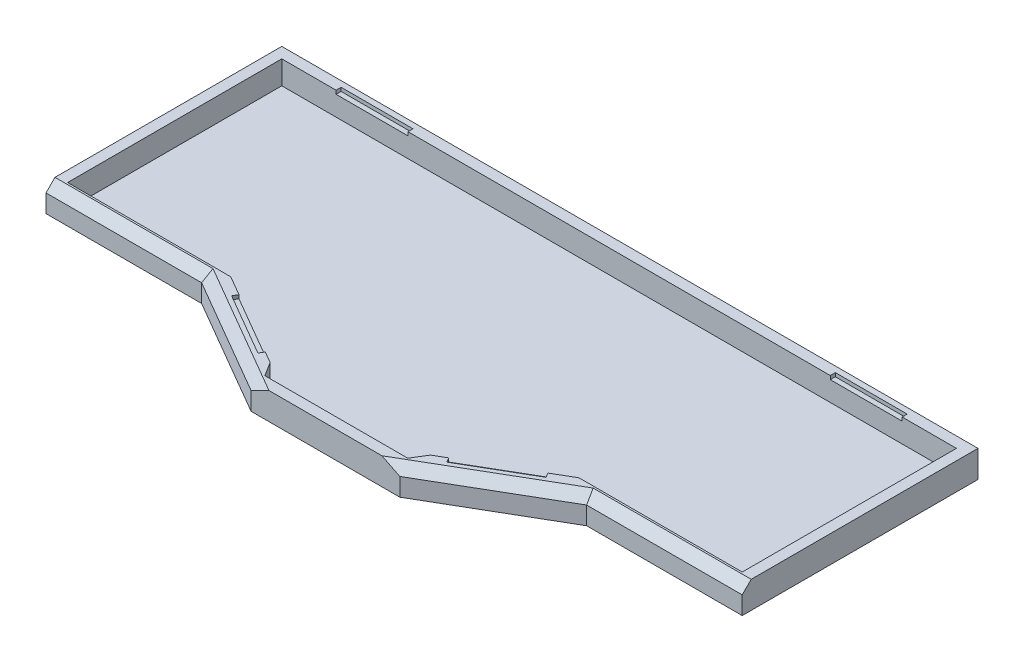
from build123d import *

# Parameters (mm, degrees)
SKETCH1_W           = 387.4
SKETCH1_H           = 169.4
BOSS_EXTRUDE1_DEPTH = 15
SKETCH2_W           = 375.4
SKETCH2_H           = 157.4
CUT_EXTRUDE1_DEPTH  = 13
SKETCH3_W           = 40
SKETCH3_H           = 2.8
CUT_EXTRUDE2_DEPTH  = 2
BOSS_EXTRUDE2_DEPTH = 13
CUT_EXTRUDE3_DEPTH  = 212.940510521
CHAMFER1_SIZE       = 5
SKETCH7_W           = 76.032406234
SKETCH7_H           = 13
BOSS_EXTRUDE3_DEPTH = 4.323125
CHAMFER3_SIZE2      = 8.130615601
CHAMFER3_SIZE       = 4.323125
CHAMFER4_SIZE2      = 4.323125
CHAMFER4_SIZE       = 7.487872147
SKETCH8_W           = 76.032406234
SKETCH8_H           = 13
BOSS_EXTRUDE4_DEPTH = 4.323125
CHAMFER5_SIZE2      = 8.130615601
CHAMFER5_SIZE       = 4.323125
CHAMFER6_SIZE2      = 4.323125
CHAMFER6_SIZE       = 7.487872147
CUT_EXTRUDE4_DEPTH  = 2


with BuildPart() as part:
    # Sketch1 → Boss-Extrude1 (new body)
    with BuildSketch(Plane(origin=(0, 0, 0), x_dir=(1, 0, 0), z_dir=(0, 1, 0))):
        Rectangle(SKETCH1_W, SKETCH1_H)
    extrude(amount=BOSS_EXTRUDE1_DEPTH)

    # Sketch2 → Cut-Extrude1 (cut)
    with BuildSketch(Plane(origin=(0, 15, 0), x_dir=(1, 0, 0), z_dir=(0, 1, 0))):
        Rectangle(SKETCH2_W, SKETCH2_H)
    extrude(amount=-CUT_EXTRUDE1_DEPTH, mode=Mode.SUBTRACT)

    # Sketch3 → Cut-Extrude2 (cut)
    with BuildSketch(Plane(origin=(0, 15, 0), x_dir=(1, 0, 0), z_dir=(0, 1, 0))):
        with Locations((137.5, 80.1)):
            Rectangle(SKETCH3_W, SKETCH3_H)
        with Locations((-137.5, 80.1)):
            Rectangle(SKETCH3_W, SKETCH3_H)
    extrude(amount=-CUT_EXTRUDE2_DEPTH, mode=Mode.SUBTRACT)

    # Sketch4 → Boss-Extrude2 (add)
    with BuildSketch(Plane(origin=(0, 2, 0), x_dir=(1, 0, 0), z_dir=(0, 1, 0))):
        Polygon((187.7, -40.5), (105.5, -40.5), (39.760462446, -78.7), (51.702725205, -78.7), (107.116680945, -46.5), (187.7, -46.5), align=None)
        Polygon((-187.7, -46.5), (-107.116680945, -46.5), (-51.702725205, -78.7), (-39.760462446, -78.7), (-105.5, -40.5), (-187.7, -40.5), align=None)
    extrude(amount=BOSS_EXTRUDE2_DEPTH)

    # Sketch5 → Cut-Extrude3 (cut, through all)
    with BuildSketch(Plane.XZ):
        Polygon((107.116680945, 46.5), (193.7, 46.5), (193.7, 84.7), (41.377143391, 84.7), (51.702725205, 78.7), align=None)
        Polygon((-193.7, 84.7), (-193.7, 46.5), (-107.116680945, 46.5), (-51.702725205, 78.7), (-41.377143391, 84.7), align=None)
    extrude(amount=-CUT_EXTRUDE3_DEPTH, mode=Mode.SUBTRACT)

    # Chamfer1
    chamfer1_edges = [part.edges().sort_by_distance(p)[0] for p in [
        (150.408340472, 15, 46.5),
        (74.246912168, 15, 65.6),
        (-150.408340472, 15, 46.5),
        (-74.246912168, 15, 65.6),
    ]]
    chamfer(chamfer1_edges, length=CHAMFER1_SIZE)

    # Sketch7 → Boss-Extrude3 (add)
    with BuildSketch(Plane(origin=(-44.223957073, 0, 76.106347822), x_dir=(-0.8646252408638723, 0, -0.5024173492835322), z_dir=(0.5024173492835322, 0, -0.8646252408638723))):
        with Locations((32.853857148, 8.5)):
            Rectangle(SKETCH7_W, SKETCH7_H)
    extrude(amount=BOSS_EXTRUDE3_DEPTH)

    # Chamfer3
    chamfer3_edges = [part.edges().sort_by_distance(p)[0] for p in [
        (-37.588449443, 8.5, 74.962117006),
    ]]
    chamfer3_side = [part.faces().sort_by_distance(p)[0] for p in [
        (-37.631889703, 8.5, 75.036874665),
    ]]
    chamfer(chamfer3_edges, length=CHAMFER3_SIZE - 0.0001, length2=CHAMFER3_SIZE2 - 0.0001, reference=chamfer3_side[0])  # a hair under: the kernel refuses the full size

    # Chamfer4
    chamfer4_edges = [part.edges().sort_by_distance(p)[0] for p in [
        (-103.327986997, 8.5, 36.762117006),
    ]]
    chamfer4_side = [part.faces().sort_by_distance(p)[0] for p in [
        (-103.253229337, 8.5, 36.805557266),
    ]]
    chamfer(chamfer4_edges, length=CHAMFER4_SIZE - 0.0001, length2=CHAMFER4_SIZE2 - 0.0001, reference=chamfer4_side[0])  # a hair under: the kernel refuses the full size

    # Sketch8 → Boss-Extrude4 (add)
    with BuildSketch(Plane(origin=(44.223957073, 0, 76.106347822), x_dir=(-0.8646252408638638, 0, 0.5024173492835469), z_dir=(-0.5024173492835469, 0, -0.8646252408638639))):
        with Locations((-32.853857148, 8.5)):
            Rectangle(SKETCH8_W, SKETCH8_H)
    extrude(amount=BOSS_EXTRUDE4_DEPTH)

    # Chamfer5
    chamfer5_edges = [part.edges().sort_by_distance(p)[0] for p in [
        (37.588449443, 8.5, 74.962117006),
    ]]
    chamfer5_side = [part.faces().sort_by_distance(p)[0] for p in [
        (37.631889703, 8.5, 75.036874665),
    ]]
    chamfer(chamfer5_edges, length=CHAMFER5_SIZE - 0.0001, length2=CHAMFER5_SIZE2 - 0.0001, reference=chamfer5_side[0])  # a hair under: the kernel refuses the full size

    # Chamfer6
    chamfer6_edges = [part.edges().sort_by_distance(p)[0] for p in [
        (103.327986997, 8.5, 36.762117006),
    ]]
    chamfer6_side = [part.faces().sort_by_distance(p)[0] for p in [
        (103.253229337, 8.5, 36.805557266),
    ]]
    chamfer(chamfer6_edges, length=CHAMFER6_SIZE - 0.0001, length2=CHAMFER6_SIZE2 - 0.0001, reference=chamfer6_side[0])  # a hair under: the kernel refuses the full size

    # Sketch9 → Cut-Extrude4 (cut)
    with BuildSketch(Plane(origin=(0, 15, 0), x_dir=(1, 0, 0), z_dir=(0, 1, 0))):
        Polygon((70.007252271, -59.593876001), (87.472682136, -49.445045546), (85.965430137, -46.851169906), (51.034570406, -67.148830817), (52.541822405, -69.742706457), align=None)
        Polygon((-70.007251916, -59.593875391), (-87.472681782, -49.445044935), (-85.965430137, -46.851169906), (-51.034570406, -67.148830817), (-52.541822051, -69.742705846), align=None)
    extrude(amount=-CUT_EXTRUDE4_DEPTH, mode=Mode.SUBTRACT)


solid = part.part
